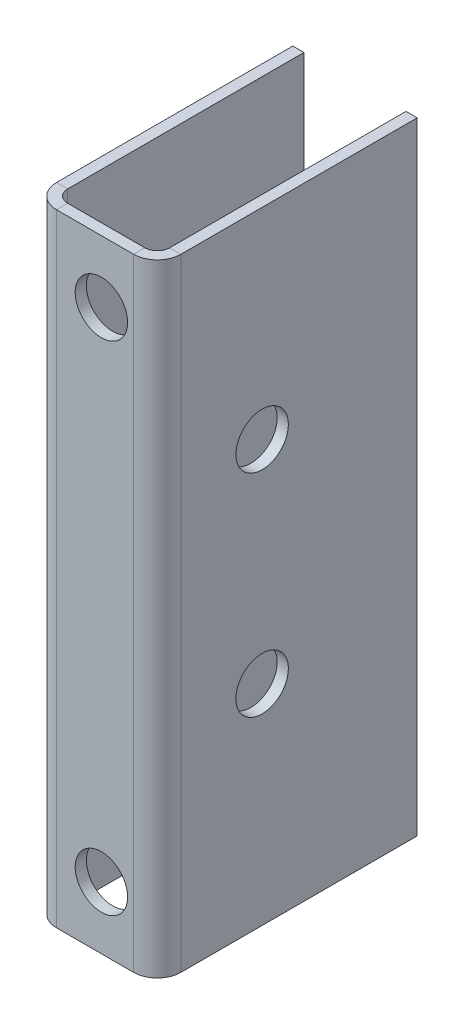
from build123d import *

# Parameters (mm, degrees)
SKETCH1_W                    = 8.2
SKETCH1_H                    = 50
BASE_FLANGE1_DEPTH           = 0.9
EDGE_FLANGE2_STRIP_W         = 5.6
EDGE_FLANGE2_STRIP_H         = 0.9
EDGE_FLANGE2_STRIP_CUT_DEPTH = 50
EDGE_FLANGE2_DEPTH           = 50
EDGE_FLANGE5_STRIP_W         = 5.6
EDGE_FLANGE5_STRIP_H         = 0.9
EDGE_FLANGE5_STRIP_CUT_DEPTH = 50
EDGE_FLANGE5_DEPTH           = 50
F_19_0_166_DIAMETER_SLOT1_D  = 4.2164
F_19_0_166_DIAMETER_SLOT2_D  = 4.2164


# Sheet-metal steps are written as plain solids
with BuildPart() as part:
    # Sketch1 → Base-Flange1 (new body)
    with BuildSketch(Plane.XY):
        with Locations((-4.344277108, 20.527108434)):
            Rectangle(SKETCH1_W, SKETCH1_H)
    extrude(amount=-BASE_FLANGE1_DEPTH)

    # Edge-Flange2 strip (across the edge) → Edge-Flange2 strip cut (cut)
    with BuildSketch(Plane(origin=(-8.444277108, -4.472891566, -0.9), x_dir=(1, 0, 0), z_dir=(0, 1, 0))):
        with Locations((-1.8, -0.45)):
            Rectangle(EDGE_FLANGE2_STRIP_W, EDGE_FLANGE2_STRIP_H)
    extrude(amount=EDGE_FLANGE2_STRIP_CUT_DEPTH, mode=Mode.SUBTRACT)

    # Edge-Flange2 section (across the edge) → Edge-Flange2 (add)
    with BuildSketch(Plane(origin=(-8.444277108, -4.472891566, -0.9), x_dir=(1, 0, 0), z_dir=(0, 1, 0))):
        with BuildLine():
            Line((-0.9, 1), (-0.9, 20))
            Line((-0.9, 20), (0, 20))
            Line((0, 20), (0, 1))
            ThreePointArc((0, 1), (0.292893219, 0.292893219), (1, 0))
            Line((1, 0), (1, -0.9))
            ThreePointArc((1, -0.9), (-0.343502884, -0.343502884), (-0.9, 1))
        make_face()
    extrude(amount=EDGE_FLANGE2_DEPTH)

    # Edge-Flange5 strip (across the edge) → Edge-Flange5 strip cut (cut)
    with BuildSketch(Plane(origin=(-0.244277108, 45.527108434, -0.9), x_dir=(-1, 0, 0), z_dir=(0, -1, 0))):
        with Locations((-1.8, -0.45)):
            Rectangle(EDGE_FLANGE5_STRIP_W, EDGE_FLANGE5_STRIP_H)
    extrude(amount=EDGE_FLANGE5_STRIP_CUT_DEPTH, mode=Mode.SUBTRACT)

    # Edge-Flange5 section (across the edge) → Edge-Flange5 (add)
    with BuildSketch(Plane(origin=(-0.244277108, 45.527108434, -0.9), x_dir=(-1, 0, 0), z_dir=(0, -1, 0))):
        with BuildLine():
            Line((-0.9, 1), (-0.9, 20))
            Line((-0.9, 20), (0, 20))
            Line((0, 20), (0, 1))
            ThreePointArc((0, 1), (0.292893219, 0.292893219), (1, 0))
            Line((1, 0), (1, -0.9))
            ThreePointArc((1, -0.9), (-0.343502884, -0.343502884), (-0.9, 1))
        make_face()
    extrude(amount=EDGE_FLANGE5_DEPTH)

    # #19 (0.166) Diameter Slot1 (through all)
    with Locations(Plane(origin=(0, 0, -0.9), x_dir=(-1, 0, 0), z_dir=(0, 0, -1))):
        with Locations((3.836019002, 40.527108434), (3.836019002, 0.527108434)):
            Hole(F_19_0_166_DIAMETER_SLOT1_D / 2)

    # #19 (0.166) Diameter Slot2 (through all)
    with Locations(Plane(origin=(0.655722892, 0, 0), x_dir=(0, 0, -1), z_dir=(1, 0, 0))):
        with Locations((8.432080696, 29.367284102), (8.432080696, 12.367284102)):
            Hole(F_19_0_166_DIAMETER_SLOT2_D / 2)


solid = part.part
